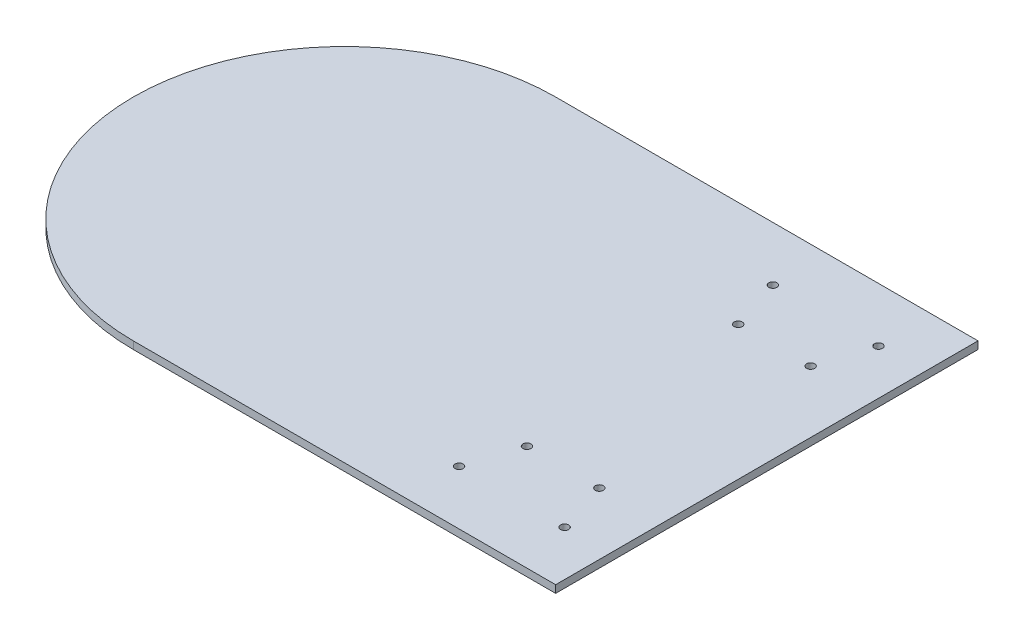
from build123d import *

# Parameters (mm, degrees)
BOSS_EXTRUDE1_DEPTH  = 3.175
M3_CLEARANCE_HOLE1_D = 3.4


with BuildPart() as part:
    # Sketch2 → Boss-Extrude1 (new body)
    with BuildSketch(Plane(origin=(0, 0, 0), x_dir=(1, 0, 0), z_dir=(0, 1, 0))):
        with BuildLine():
            Line((0, 0), (0, 177.8))
            Line((0, 177.8), (-177.8, 177.8))
            ThreePointArc((-177.8, 177.8), (-266.7, 88.9), (-177.8, 0))
            Line((-177.8, 0), (0, 0))
        make_face()
    extrude(amount=BOSS_EXTRUDE1_DEPTH)

    # M3 Clearance Hole1 (through all)
    with Locations(Plane(origin=(0, 3.175, 0), x_dir=(1, 0, 0), z_dir=(0, 1, 0))):
        with Locations((-63.5, 154.95524), (-19.05, 154.95524), (-56.515, 133.36524), (-26.035, 133.36524), (-56.515, 44.43476), (-26.035, 44.43476), (-63.5, 22.84476), (-19.05, 22.84476)):
            Hole(M3_CLEARANCE_HOLE1_D / 2)


solid = part.part
